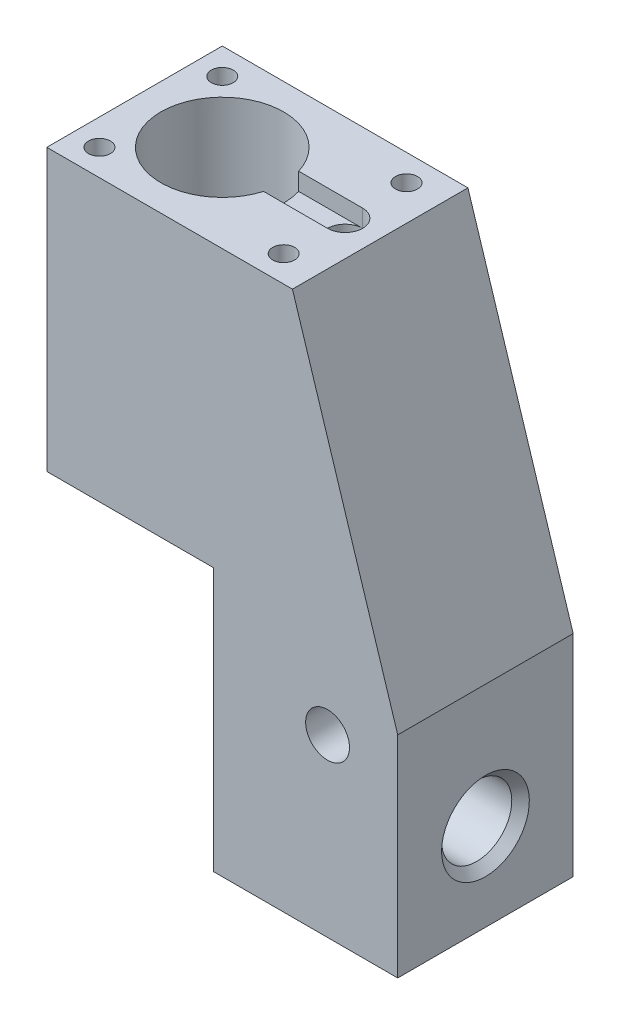
from build123d import *

# Parameters (mm, degrees)
BOSS_EXTRUDE2_DEPTH     = 10
CUT_EXTRUDE1_DEPTH      = 67.219332525
CUT_EXTRUDE2_DEPTH      = 2
M3_TAPPED_HOLE1_D       = 2.5
M3_TAPPED_HOLE1_DEPTH   = 9
SKETCH9_R               = 2.5
CUT_EXTRUDE3_DEPTH      = 44.185645763
SKETCH10_R              = 4
CUT_EXTRUDE4_DEPTH      = 53.191953403
CHAMFER1_SIZE           = 1
CUT_EXTRUDE5_REACH      = 54.192
CUT_EXTRUDE5_END_RADIUS = 7
SKETCH13_R              = 1.6
M4_TAPPED_HOLE1_REACH   = 68.219
M4_TAPPED_HOLE1_BORE_R  = 1.65
CUT_EXTRUDE6_REACH      = 68.219
CUT_EXTRUDE6_END_RADIUS = 2.5
SKETCH19_R              = 1.25


# Read off the part's stored shape, not the designer's step: Hole1
with BuildPart() as part:
    # Sketch4 → Boss-Extrude2 (new, symmetric)
    with BuildSketch(Plane.XY):
        Polygon((0, 0), (-19, 0), (-19, 32), (9, 32), (21, -6), (21, -30), (0, -30), align=None)
    extrude(amount=BOSS_EXTRUDE2_DEPTH, both=True)

    # Sketch6 → Cut-Extrude1 (cut, through all)
    with BuildSketch(Plane(origin=(0, 32, 0), x_dir=(1, 0, 0), z_dir=(0, 1, 0))):
        with BuildLine():
            ThreePointArc((-2.291796068, 2), (-10.010587075, 6.926666858), (-16, 0))
            Line((-16, 0), (-2, 0))
            ThreePointArc((-2, 0), (-2.073333142, 1.010587075), (-2.291796068, 2))
        make_face()
        with BuildLine():
            Line((-2, 0), (-16, 0))
            ThreePointArc((-16, 0), (-10.010587075, -6.926666858), (-2.291796068, -2))
            ThreePointArc((-2.291796068, -2), (-2.073333142, -1.010587075), (-2, 0))
        make_face()
    extrude(amount=-CUT_EXTRUDE1_DEPTH, mode=Mode.SUBTRACT)

    # Sketch6<3> → Cut-Extrude2 (cut)
    with BuildSketch(Plane(origin=(0, 32, 0), x_dir=(1, 0, 0), z_dir=(0, 1, 0))):
        with BuildLine():
            ThreePointArc((5, 2), (3.585786438, 1.414213562), (3, 0))
            Line((3, 0), (7, 0))
            ThreePointArc((7, 0), (6.414213562, 1.414213562), (5, 2))
        make_face()
        with BuildLine():
            Line((7, 0), (3, 0))
            ThreePointArc((3, 0), (3.585786438, -1.414213562), (5, -2))
            ThreePointArc((5, -2), (6.414213562, -1.414213562), (7, 0))
        make_face()
        with BuildLine():
            ThreePointArc((-2.291796068, 2), (-2.073333142, 1.010587075), (-2, 0))
            Line((-2, 0), (3, 0))
            ThreePointArc((3, 0), (3.585786438, 1.414213562), (5, 2))
            Line((5, 2), (-2.291796068, 2))
        make_face()
        with BuildLine():
            Line((3, 0), (-2, 0))
            ThreePointArc((-2, 0), (-2.073333142, -1.010587075), (-2.291796068, -2))
            Line((-2.291796068, -2), (5, -2))
            ThreePointArc((5, -2), (3.585786438, -1.414213562), (3, 0))
        make_face()
    extrude(amount=-CUT_EXTRUDE2_DEPTH, mode=Mode.SUBTRACT)

    # M3 Tapped Hole1
    with Locations(Plane(origin=(0, 32, 0), x_dir=(1, 0, 0), z_dir=(0, 1, 0))):
        with Locations((-16, 7), (-16, -7), (5, -7), (5, 7)):
            Hole(M3_TAPPED_HOLE1_D / 2, depth=M3_TAPPED_HOLE1_DEPTH)

    # Sketch9 → Cut-Extrude3 (cut, through all)
    with BuildSketch(Plane.XY.offset(10)):
        with Locations((13, -10)):
            Circle(SKETCH9_R)
    extrude(amount=-CUT_EXTRUDE3_DEPTH, mode=Mode.SUBTRACT)

    # Sketch10 → Cut-Extrude4 (cut, through all)
    with BuildSketch(Plane(origin=(21, 0, 0), x_dir=(0, 0, -1), z_dir=(1, 0, 0))):
        with Locations(Location((0, -20, 0), (0, 0, 90))):
            Circle(SKETCH10_R)
    extrude(amount=-CUT_EXTRUDE4_DEPTH, mode=Mode.SUBTRACT)

    # Chamfer1
    chamfer1_edges = [part.edges().sort_by_distance(p)[0] for p in [
        (21, -24, 0),
    ]]
    chamfer(chamfer1_edges, length=CHAMFER1_SIZE)

    # Hole1 outline → Hole1 (revolve, cut)
    with BuildSketch(Plane(origin=(5, 0, 0), x_dir=(1, 0, 0), z_dir=(0, 0, 1))):
        Polygon((1.25, 0), (2, 0), (2, 32), (0, 32), (0, -16.200355886), (1.25, -16.200355886), align=None)
    revolve(axis=Axis((5, 0, 0), (0, 1, 0)), mode=Mode.SUBTRACT)

    # Cut-Extrude5: up to this cylinder (the profile starts outside it)
    cut_extrude5_end = Plane(origin=(-9, 15, 0), z_dir=(0, 1, 0)) * Cylinder(CUT_EXTRUDE5_END_RADIUS, 123.384, mode=Mode.PRIVATE)
    # Sketch13 → Cut-Extrude5 (cut, up to the surface)
    with BuildSketch(Plane.ZY.offset(19), mode=Mode.PRIVATE) as cut_extrude5_sk1:
        with Locations((-3, 15)):
            Circle(SKETCH13_R)
    cut_extrude5_tool1 = extrude(cut_extrude5_sk1.sketch, amount=-CUT_EXTRUDE5_REACH, mode=Mode.PRIVATE) - cut_extrude5_end
    add(cut_extrude5_tool1.solids().sort_by_distance((-19, 15, -3))[0], mode=Mode.SUBTRACT)
    # Sketch13 → Cut-Extrude5 (cut, up to the surface)
    with BuildSketch(Plane.ZY.offset(19), mode=Mode.PRIVATE) as cut_extrude5_sk2:
        with Locations((3, 15)):
            Circle(SKETCH13_R)
    cut_extrude5_tool2 = extrude(cut_extrude5_sk2.sketch, amount=-CUT_EXTRUDE5_REACH, mode=Mode.PRIVATE) - cut_extrude5_end
    add(cut_extrude5_tool2.solids().sort_by_distance((-19, 15, 3))[0], mode=Mode.SUBTRACT)

    # M4 Tapped Hole1 bore → M4 Tapped Hole1 (cut, up to next)
    with BuildSketch(Plane(origin=(0, -30, 0), x_dir=(-1, 0, 0), z_dir=(0, -1, 0)), mode=Mode.PRIVATE) as m4_tapped_hole1_sk1:
        with Locations((-13, 0)):
            Circle(M4_TAPPED_HOLE1_BORE_R)
    m4_tapped_hole1_tool1 = extrude(m4_tapped_hole1_sk1.sketch, amount=-M4_TAPPED_HOLE1_REACH, mode=Mode.PRIVATE) & part.part
    # M4 Tapped Hole1 bore → M4 Tapped Hole1 (cut, up to next)
    with BuildSketch(Plane(origin=(0, -30, 0), x_dir=(-1, 0, 0), z_dir=(0, -1, 0)), mode=Mode.PRIVATE) as m4_tapped_hole1_sk2:
        with Locations((-5, 0)):
            Circle(M4_TAPPED_HOLE1_BORE_R)
    m4_tapped_hole1_tool2 = extrude(m4_tapped_hole1_sk2.sketch, amount=-M4_TAPPED_HOLE1_REACH, mode=Mode.PRIVATE) & part.part
    add(m4_tapped_hole1_tool1.solids().sort_by_distance((13, -30, 0))[0], mode=Mode.SUBTRACT)
    add(m4_tapped_hole1_tool2.solids().sort_by_distance((5, -30, 0))[0], mode=Mode.SUBTRACT)

    # Cut-Extrude6: up to this cylinder (the profile starts outside it)
    cut_extrude6_end = Plane(origin=(13, -10, 0), z_dir=(0, 0, 1)) * Cylinder(CUT_EXTRUDE6_END_RADIUS, 142.438, mode=Mode.PRIVATE)
    # Sketch19 → Cut-Extrude6 (cut, up to the surface)
    with BuildSketch(Plane.XZ.offset(30), mode=Mode.PRIVATE) as cut_extrude6_sk1:
        with Locations((13, 0)):
            Circle(SKETCH19_R)
    cut_extrude6_tool1 = extrude(cut_extrude6_sk1.sketch, amount=-CUT_EXTRUDE6_REACH, mode=Mode.PRIVATE) - cut_extrude6_end
    add(cut_extrude6_tool1.solids().sort_by_distance((13, -30, 0))[0], mode=Mode.SUBTRACT)


solid = part.part
